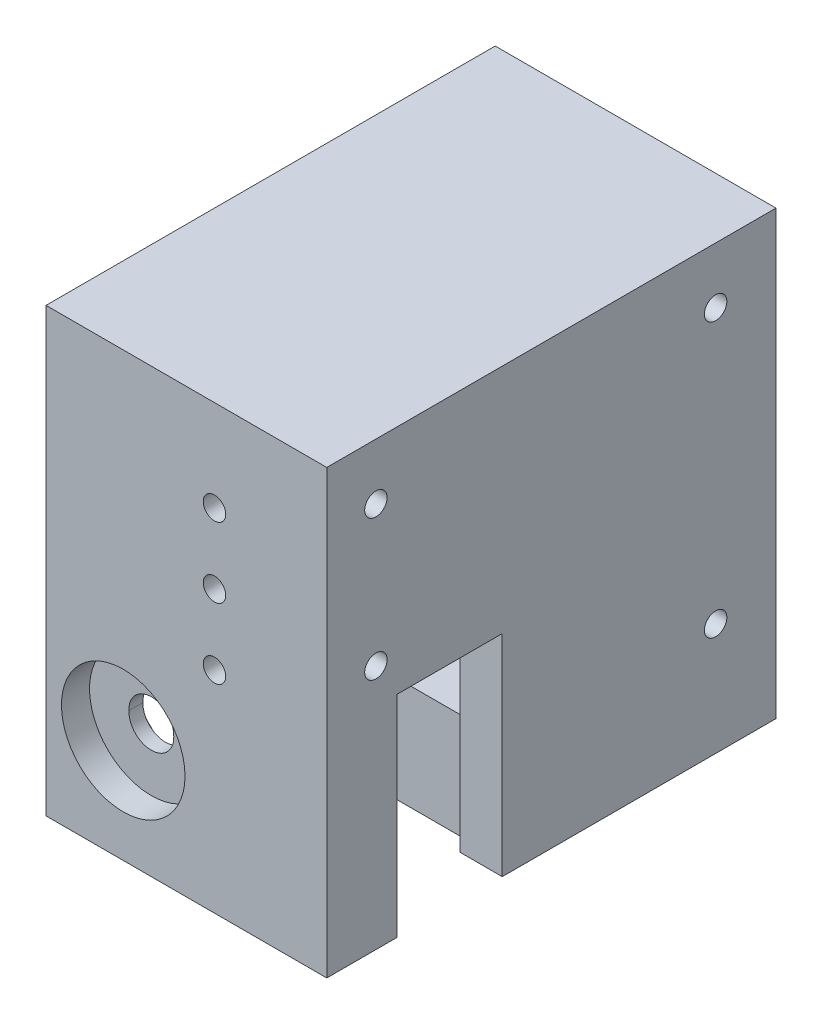
from build123d import *

# Parameters (mm, degrees)
SKETCH1_W            = 50.8
SKETCH1_H            = 76.2
BOSS_EXTRUDE1_DEPTH  = 12.7
SKETCH3_R            = 2.032
CUT_EXTRUDE1_DEPTH   = 12.7
SKETCH17_W           = 7.62
SKETCH17_H           = 76.2
BOSS_EXTRUDE13_DEPTH = 68.58
SKETCH18_W           = 3.81
SKETCH18_H           = 19.05
BOSS_EXTRUDE14_DEPTH = 43.18
SKETCH19_W           = 29.21
SKETCH19_H           = 19.05
BOSS_EXTRUDE15_DEPTH = 43.18
SKETCH4_R            = 4.064
CUT_EXTRUDE5_DEPTH   = 125.729995039
CUT_EXTRUDE6_START   = -5.08
SKETCH21_R           = 11.176
SKETCH21_R_2         = 4.064
CUT_EXTRUDE6_DEPTH   = 5.08
SKETCH22_R           = 11.176
SKETCH22_R_2         = 4.064
CUT_EXTRUDE7_DEPTH   = 5.08
SKETCH23_W           = 19.05
SKETCH23_H           = 38.1
CUT_EXTRUDE8_DEPTH   = 115.424594585
SKETCH24_W           = 44.45
SKETCH24_H           = 25.448429418
CUT_EXTRUDE9_DEPTH   = 7.62
SKETCH26_W           = 18.542
SKETCH26_H           = 46.99
BOSS_EXTRUDE16_DEPTH = 57.15
SKETCH28_W           = 50.8
SKETCH28_H           = 81.28
BOSS_EXTRUDE18_DEPTH = 3.81
SKETCH35_R           = 4.064
CUT_EXTRUDE10_DEPTH  = 125.729995039
SKETCH32_R           = 2.032
CUT_EXTRUDE12_DEPTH  = 9.525
SKETCH41_R           = 2.032
CUT_EXTRUDE14_DEPTH  = 9.525
SKETCH43_R           = 3.96875
CUT_EXTRUDE15_DEPTH  = 4.7625


with BuildPart() as part:
    # Sketch1 → Boss-Extrude1 (new body)
    with BuildSketch(Plane.XY):
        with Locations((23.853164533, -42.679075546)):
            Rectangle(SKETCH1_W, SKETCH1_H)
    extrude(amount=BOSS_EXTRUDE1_DEPTH)

    # Sketch3 → Cut-Extrude1 (cut)
    with BuildSketch(Plane.XY.offset(12.7)):
        with Locations((28.933164533, -42.679075546)):
            Circle(SKETCH3_R)
        with Locations((28.933164533, -29.979075546)):
            Circle(SKETCH3_R)
        with Locations((28.933164533, -17.279075546)):
            Circle(SKETCH3_R)
    extrude(amount=-CUT_EXTRUDE1_DEPTH, mode=Mode.SUBTRACT)

    # Sketch17 → Boss-Extrude13 (add)
    with BuildSketch(Plane(origin=(0, 0, 0), x_dir=(-1, 0, 0), z_dir=(0, 0, -1))):
        with Locations((-45.443164533, -42.679075546)):
            Rectangle(SKETCH17_W, SKETCH17_H)
    extrude(amount=BOSS_EXTRUDE13_DEPTH)

    # Sketch18 → Boss-Extrude14 (add)
    with BuildSketch(Plane.ZY.offset(-41.633164533)):
        with Locations((-66.675, -71.254075546)):
            Rectangle(SKETCH18_W, SKETCH18_H)
    extrude(amount=BOSS_EXTRUDE14_DEPTH)

    # Sketch19 → Boss-Extrude15 (add)
    with BuildSketch(Plane.ZY.offset(-41.633164533)):
        with Locations((-36.195, -71.254075546)):
            Rectangle(SKETCH19_W, SKETCH19_H)
    extrude(amount=BOSS_EXTRUDE15_DEPTH)

    # Sketch4 → Cut-Extrude5 (cut, through all)
    with BuildSketch(Plane.XY.offset(12.7)):
        with Locations((12.423164533, -61.981404421)):
            Circle(SKETCH4_R)
    extrude(amount=-CUT_EXTRUDE5_DEPTH, mode=Mode.SUBTRACT)

    # Sketch21 → Cut-Extrude6 (cut)
    with BuildSketch(Plane(origin=(0, 0, 0), x_dir=(-1, 0, 0), z_dir=(0, 0, -1)).offset(CUT_EXTRUDE6_START)):
        with Locations((-12.423164533, -61.981404421)):
            Circle(SKETCH21_R)
        with Locations((-12.423164533, -61.981404421)):
            Circle(SKETCH21_R_2, mode=Mode.SUBTRACT)
    extrude(amount=CUT_EXTRUDE6_DEPTH, mode=Mode.SUBTRACT)

    # Sketch22 → Cut-Extrude7 (cut)
    with BuildSketch(Plane.XY.offset(12.7)):
        with Locations((12.423164533, -61.981404421)):
            Circle(SKETCH22_R)
        with Locations((12.423164533, -61.981404421)):
            Circle(SKETCH22_R_2, mode=Mode.SUBTRACT)
    extrude(amount=-CUT_EXTRUDE7_DEPTH, mode=Mode.SUBTRACT)

    # Sketch23 → Cut-Extrude8 (cut, through all)
    with BuildSketch(Plane.ZY.offset(-41.633164533)):
        with Locations((-9.525, -61.729075546)):
            Rectangle(SKETCH23_W, SKETCH23_H)
    extrude(amount=-CUT_EXTRUDE8_DEPTH, mode=Mode.SUBTRACT)

    # Sketch24 → Cut-Extrude9 (cut)
    with BuildSketch(Plane.XZ.offset(80.779075546)):
        with Locations((23.218164533, -36.808482529)):
            Rectangle(SKETCH24_W, SKETCH24_H)
    extrude(amount=-CUT_EXTRUDE9_DEPTH, mode=Mode.SUBTRACT)

    # Sketch26 → Boss-Extrude16 (add)
    with BuildSketch(Plane(origin=(0, -61.729075546, 0), x_dir=(1, 0, 0), z_dir=(0, 1, 0))):
        with Locations((7.724164533, 45.085)):
            Rectangle(SKETCH26_W, SKETCH26_H)
    extrude(amount=BOSS_EXTRUDE16_DEPTH)

    # Sketch28 → Boss-Extrude18 (add)
    with BuildSketch(Plane(origin=(0, -4.579075546, 0), x_dir=(1, 0, 0), z_dir=(0, 1, 0))):
        with Locations((23.853164533, 27.94)):
            Rectangle(SKETCH28_W, SKETCH28_H)
    extrude(amount=BOSS_EXTRUDE18_DEPTH)

    # Sketch35 → Cut-Extrude10 (cut, through all)
    with BuildSketch(Plane.XY.offset(12.7)):
        with Locations((12.423164533, -61.729075546)):
            Circle(SKETCH35_R)
    extrude(amount=-CUT_EXTRUDE10_DEPTH, mode=Mode.SUBTRACT)

    # Sketch32 → Cut-Extrude12 (cut)
    with BuildSketch(Plane(origin=(49.253164533, 0, 0), x_dir=(0, 0, -1), z_dir=(1, 0, 0))):
        with Locations((-3.81, -36.329075546)):
            Circle(SKETCH32_R)
        with Locations((-3.81, -10.929075546)):
            Circle(SKETCH32_R)
    extrude(amount=-CUT_EXTRUDE12_DEPTH, mode=Mode.SUBTRACT)

    # Sketch41 → Cut-Extrude14 (cut)
    with BuildSketch(Plane.ZY.offset(-41.633164533)):
        with Locations((-57.658, -10.929075546)):
            Circle(SKETCH41_R)
        with Locations((-57.658, -60.459075546)):
            Circle(SKETCH41_R)
    extrude(amount=-CUT_EXTRUDE14_DEPTH, mode=Mode.SUBTRACT)

    # Sketch43 → Cut-Extrude15 (cut)
    with BuildSketch(Plane.ZY.offset(-41.633164533)):
        with Locations((-57.658, -10.929075546)):
            Circle(SKETCH43_R)
        with Locations((-57.658, -60.459075546)):
            Circle(SKETCH43_R)
    extrude(amount=-CUT_EXTRUDE15_DEPTH, mode=Mode.SUBTRACT)


solid = part.part
